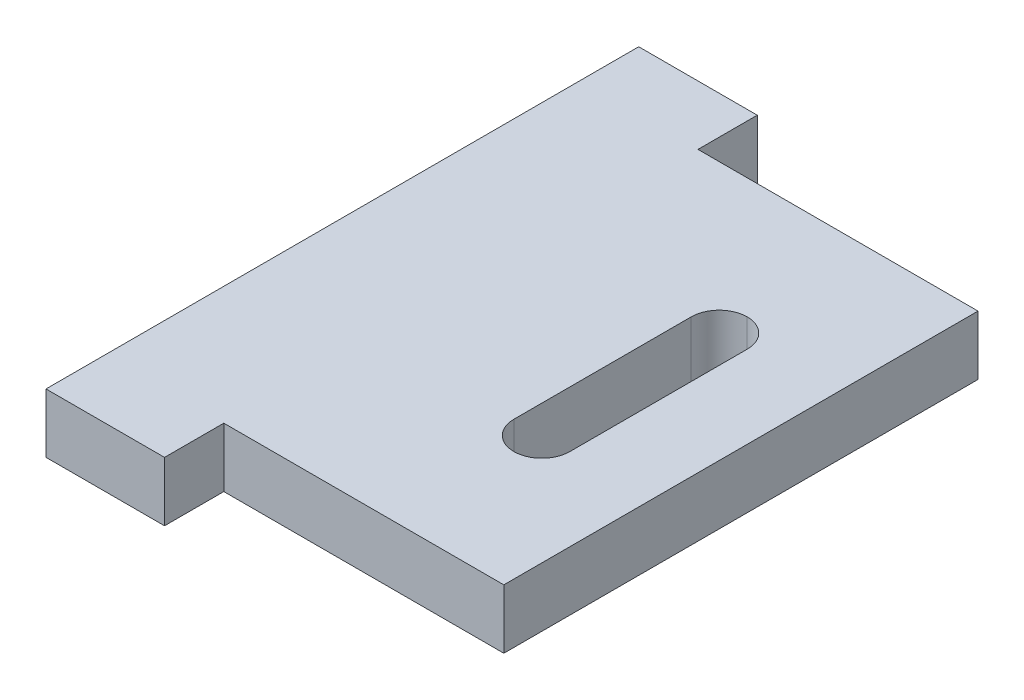
from build123d import *

# Parameters (mm, degrees)
SKETCH1_W               = 15
SKETCH1_H               = 25.4
BOSS_EXTRUDE1_DEPTH     = 3.175
CUT_EXTRUDE1_DEPTH      = 22.305369042
CUT_EXTRUDE1_DEPTH_BACK = 22.305369042
SKETCH2_W               = 3
SKETCH2_H               = 12.5
FILLET1_R               = 1.5


with BuildPart() as part:
    # Sketch1 → Boss-Extrude1 (new body)
    with BuildSketch(Plane(origin=(0, 0, 0), x_dir=(1, 0, 0), z_dir=(0, 1, 0))):
        Polygon((-7.5, -12.7), (-7.5, 12.7), (-7.5, 15.875), (-13.85, 15.875), (-13.85, -15.875), (-7.5, -15.875), align=None)
        Rectangle(SKETCH1_W, SKETCH1_H)
    extrude(amount=BOSS_EXTRUDE1_DEPTH)

    # Sketch2 → Cut-Extrude1 (cut, two sides: drawn at the far end of the back side and taken through both)
    with BuildSketch(Plane(origin=(0, 3.175, 0), x_dir=(1, 0, 0), z_dir=(0, 1, 0)).offset(-CUT_EXTRUDE1_DEPTH_BACK)):
        with Locations((1.5875, 0)):
            Rectangle(SKETCH2_W, SKETCH2_H)
    extrude(amount=CUT_EXTRUDE1_DEPTH + CUT_EXTRUDE1_DEPTH_BACK, mode=Mode.SUBTRACT)

    # Fillet1
    fillet1_edges = [part.edges().sort_by_distance(p)[0] for p in [
        (3.0875, 1.5875, -6.25),
        (3.0875, 1.5875, 6.25),
        (0.0875, 1.5875, 6.25),
        (0.0875, 1.5875, -6.25),
    ]]
    fillet(fillet1_edges, radius=FILLET1_R - 0.0001)  # a hair under: the kernel refuses the full size


solid = part.part
